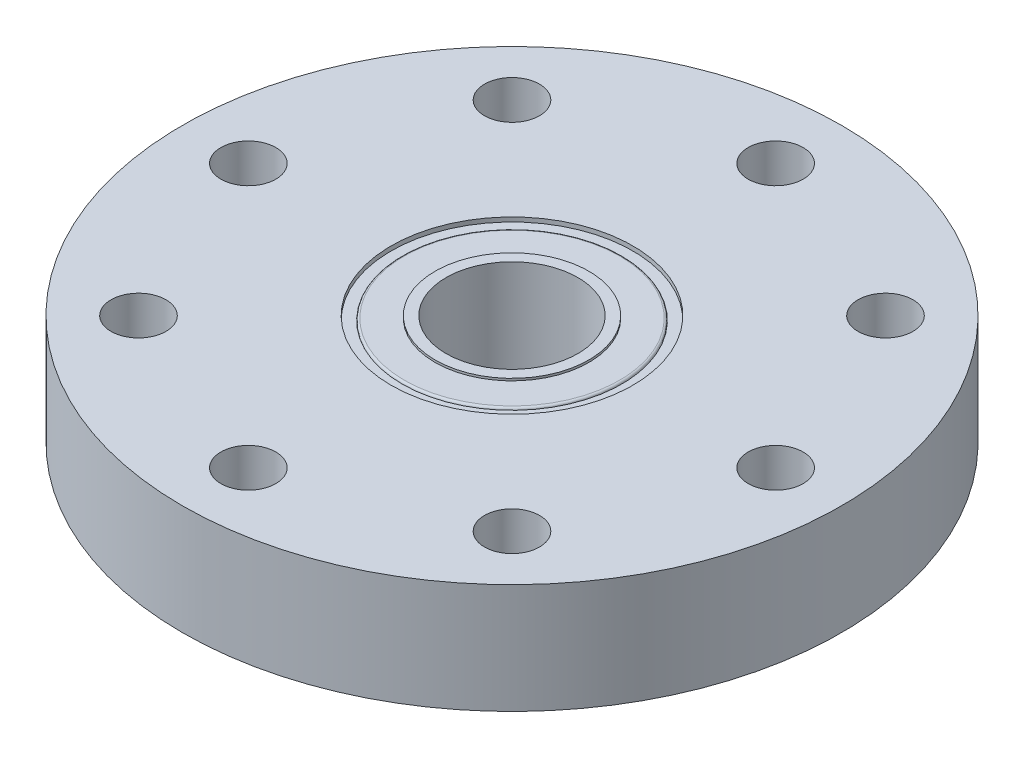
from build123d import *

# Parameters (mm, degrees)
SKETCH1_R           = 15
SKETCH1_R_2         = 1.25
SKETCH1_R_3         = 3
BOSS_EXTRUDE1_DEPTH = 5
SKETCH4_R           = 5.5
SKETCH4_R_2         = 5
CUT_EXTRUDE1_DEPTH  = 0.2
SKETCH4_3_R         = 5
SKETCH4_3_R_2       = 3.5
CUT_EXTRUDE2_DEPTH  = 0.1
CUT_EXTRUDE3_START  = -0.1
SKETCH5_R           = 5
SKETCH5_R_2         = 3.5
CUT_EXTRUDE3_DEPTH  = 0.1
CUT_EXTRUDE4_START  = -0.2
SKETCH5_3_R         = 5.75
SKETCH5_3_R_2       = 5
CUT_EXTRUDE4_DEPTH  = 0.2
FILLET1_R           = 0.1


with BuildPart() as part:
    # Sketch1 → Boss-Extrude1 (new body)
    with BuildSketch(Plane(origin=(0, 0, 0), x_dir=(1, 0, 0), z_dir=(0, 1, 0))):
        with Locations(Location((0, 0, 0), (0, 0, 270))):
            Circle(SKETCH1_R)
        with Locations(Location((0, 12, 0), (0, 0, 270))):
            Circle(SKETCH1_R_2, mode=Mode.SUBTRACT)
        with Locations(Location((0, -12, 0), (0, 0, 270))):
            Circle(SKETCH1_R_2, mode=Mode.SUBTRACT)
        with Locations(Location((0, 0, 0), (0, 0, 270))):
            Circle(SKETCH1_R_3, mode=Mode.SUBTRACT)
        with Locations(Location((-12, 0, 0), (0, 0, 270))):
            Circle(SKETCH1_R_2, mode=Mode.SUBTRACT)
        with Locations(Location((12, 0, 0), (0, 0, 270))):
            Circle(SKETCH1_R_2, mode=Mode.SUBTRACT)
        with Locations(Location((8.5, 8.5, 0), (0, 0, 270))):
            Circle(SKETCH1_R_2, mode=Mode.SUBTRACT)
        with Locations(Location((8.5, -8.5, 0), (0, 0, 270))):
            Circle(SKETCH1_R_2, mode=Mode.SUBTRACT)
        with Locations(Location((-8.5, -8.5, 0), (0, 0, 270))):
            Circle(SKETCH1_R_2, mode=Mode.SUBTRACT)
        with Locations(Location((-8.5, 8.5, 0), (0, 0, 270))):
            Circle(SKETCH1_R_2, mode=Mode.SUBTRACT)
    extrude(amount=BOSS_EXTRUDE1_DEPTH)

    # Sketch4 → Cut-Extrude1 (cut)
    with BuildSketch(Plane(origin=(0, 5, 0), x_dir=(1, 0, 0), z_dir=(0, 1, 0))):
        with Locations(Location((0, 0, 0), (0, 0, 270))):
            Circle(SKETCH4_R)
        with Locations(Location((0, 0, 0), (0, 0, 270))):
            Circle(SKETCH4_R_2, mode=Mode.SUBTRACT)
    extrude(amount=-CUT_EXTRUDE1_DEPTH, mode=Mode.SUBTRACT)

    # Sketch4<3> → Cut-Extrude2 (cut)
    with BuildSketch(Plane(origin=(0, 5, 0), x_dir=(1, 0, 0), z_dir=(0, 1, 0))):
        with Locations(Location((0, 0, 0), (0, 0, 270))):
            Circle(SKETCH4_3_R)
        with Locations(Location((0, 0, 0), (0, 0, 270))):
            Circle(SKETCH4_3_R_2, mode=Mode.SUBTRACT)
    extrude(amount=-CUT_EXTRUDE2_DEPTH, mode=Mode.SUBTRACT)

    # Sketch5 → Cut-Extrude3 (cut)
    with BuildSketch(Plane.XZ.offset(CUT_EXTRUDE3_START)):
        with Locations(Location((0, 0, 0), (0, 0, 90))):
            Circle(SKETCH5_R)
        with Locations(Location((0, 0, 0), (0, 0, 90))):
            Circle(SKETCH5_R_2, mode=Mode.SUBTRACT)
    extrude(amount=CUT_EXTRUDE3_DEPTH, mode=Mode.SUBTRACT)

    # Sketch5<3> → Cut-Extrude4 (cut)
    with BuildSketch(Plane.XZ.offset(CUT_EXTRUDE4_START)):
        with Locations(Location((0, 0, 0), (0, 0, 270))):
            Circle(SKETCH5_3_R)
        with Locations(Location((0, 0, 0), (0, 0, 90))):
            Circle(SKETCH5_3_R_2, mode=Mode.SUBTRACT)
    extrude(amount=CUT_EXTRUDE4_DEPTH, mode=Mode.SUBTRACT)

    # Fillet1
    fillet1_edges = [part.edges().sort_by_distance(p)[0] for p in [
        (0, 4.9, -5),
        (0, 0.1, -5),
    ]]
    fillet(fillet1_edges, radius=FILLET1_R - 0.0001)  # a hair under: the kernel refuses the full size


solid = part.part
